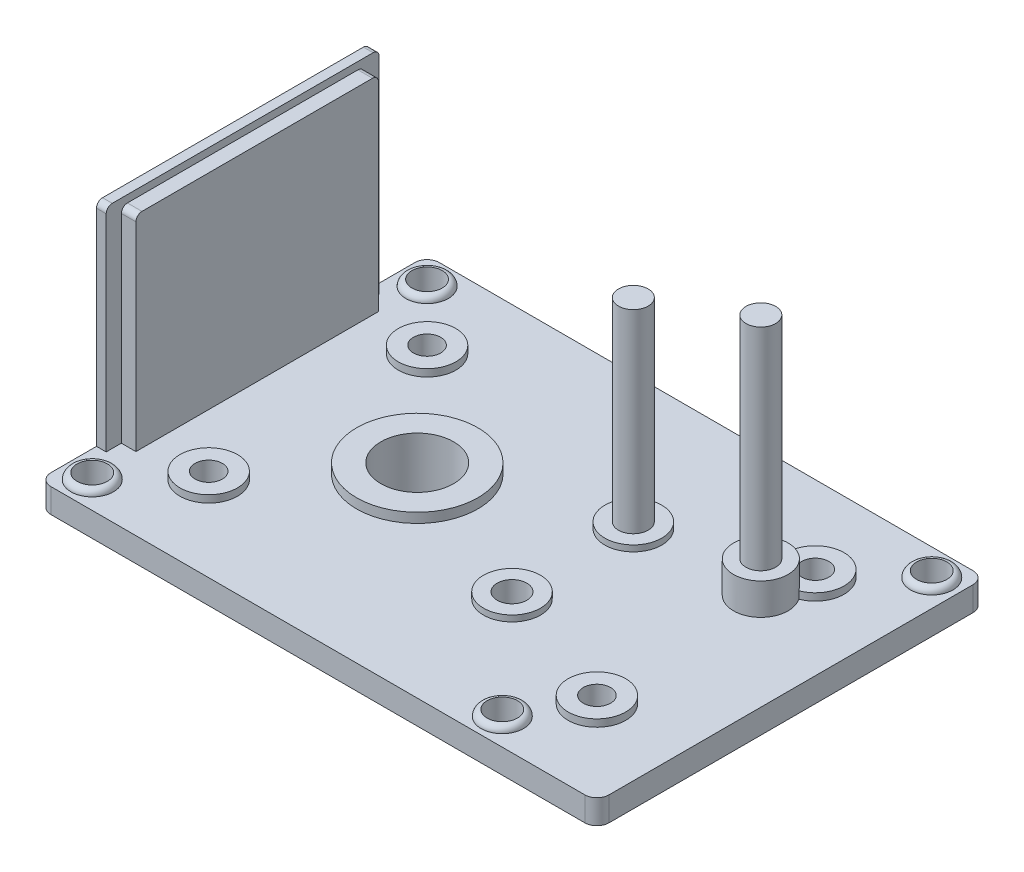
from build123d import *
from build123d.topology import SkipClean

# Parameters (mm, degrees)
SKETCH1_W                                            = 46
SKETCH1_H                                            = 32
BOSS_EXTRUDE1_DEPTH                                  = 2
BOSS_EXTRUDE2_DEPTH                                  = 17.5
SKETCH3_W                                            = 1.2
SKETCH3_H                                            = 20
CUT_EXTRUDE1_DEPTH                                   = 0.6
FILLET1_R                                            = 0.5
FILLET2_R                                            = 1
SKETCH4_R                                            = 2.375
BOSS_EXTRUDE3_DEPTH                                  = 0.6
SKETCH6_R                                            = 1
BOSS_EXTRUDE4_DEPTH                                  = 0.75
CSK_FOR_M6_HEX_SOCKET_COUNTERSUNK_CAP_SC_D           = 2.5
CSK_FOR_M6_HEX_SOCKET_COUNTERSUNK_CAP_SC_CSINK_D     = 4
CSK_FOR_M6_HEX_SOCKET_COUNTERSUNK_CAP_SC_CSINK_ANGLE = 90
BOSS_EXTRUDE5_START                                  = 0.5
SKETCH13_R                                           = 1.75
SKETCH13_R_2                                         = 1.25
BOSS_EXTRUDE5_DEPTH                                  = 0.5
FILLET3_R                                            = 0.5
SKETCH14_R                                           = 5
SKETCH14_R_2                                         = 3
BOSS_EXTRUDE6_DEPTH                                  = 0.8
SKETCH15_R                                           = 3
CUT_EXTRUDE2_DEPTH                                   = 34.034073318
SKETCH16_R                                           = 6.625
SKETCH16_R_2                                         = 3
BOSS_EXTRUDE7_DEPTH                                  = 1.6
SKETCH18_R                                           = 3.75
BOSS_EXTRUDE9_DEPTH                                  = 2
SKETCH20_R                                           = 2.35
SKETCH20_R_2                                         = 1.225
BOSS_EXTRUDE10_DEPTH                                 = 0.5
BOSS_EXTRUDE11_DEPTH                                 = 3
CUT_EXTRUDE5_START                                   = -3
SKETCH23_R                                           = 1.225
CUT_EXTRUDE5_DEPTH                                   = 3
SKETCH24_R                                           = 2.25
SKETCH24_R_2                                         = 1.225
BOSS_EXTRUDE12_DEPTH                                 = 2.6
SKETCH25_R                                           = 1.225
BOSS_EXTRUDE13_DEPTH                                 = 19
SKETCH27_R                                           = 1.225
BOSS_EXTRUDE15_DEPTH                                 = 20
SKETCH29_R                                           = 1.125
CUT_EXTRUDE6_DEPTH                                   = 37.891733491


with BuildPart() as part:
    # Sketch1 → Boss-Extrude1 (new body)
    with BuildSketch(Plane(origin=(0, 0, 0), x_dir=(1, 0, 0), z_dir=(0, 1, 0))):
        Rectangle(SKETCH1_W, SKETCH1_H)
    extrude(amount=BOSS_EXTRUDE1_DEPTH)

    # Sketch2 → Boss-Extrude2 (add)
    with BuildSketch(Plane(origin=(0, 2, 0), x_dir=(1, 0, 0), z_dir=(0, 1, 0))):
        Polygon((-23, -11.25), (-23, 11.25), (-22.2, 11.25), (-22.2, 10), (-21, 10), (-21, -10), (-22.2, -10), (-22.2, -11.25), align=None)
    extrude(amount=BOSS_EXTRUDE2_DEPTH)

    # Sketch3 → Cut-Extrude1 (cut)
    with BuildSketch(Plane(origin=(0, 19.5, 0), x_dir=(1, 0, 0), z_dir=(0, 1, 0))):
        with Locations((-21.6, 0)):
            Rectangle(SKETCH3_W, SKETCH3_H)
    extrude(amount=-CUT_EXTRUDE1_DEPTH, mode=Mode.SUBTRACT)

    # Fillet1
    fillet1_edges = [part.edges().sort_by_distance(p)[0] for p in [
        (-22.6, 19.5, -11.25),
        (-22.6, 19.5, 11.25),
        (-21.6, 18.9, 10),
        (-21.6, 18.9, -10),
    ]]
    fillet(fillet1_edges, radius=FILLET1_R)

    # Fillet2
    fillet2_edges = [part.edges().sort_by_distance(p)[0] for p in [
        (-23, 1, -16),
        (23, 1, -16),
        (23, 1, 16),
        (-23, 1, 16),
    ]]
    fillet(fillet2_edges, radius=FILLET2_R)

    # Sketch4 → Boss-Extrude3 (add)
    with BuildSketch(Plane(origin=(0, 2, 0), x_dir=(1, 0, 0), z_dir=(0, 1, 0))):
        with Locations(Location((16, 9, 0), (0, 0, 270))):
            Circle(SKETCH4_R)
        with Locations(Location((-16, 9, 0), (0, 0, 270))):
            Circle(SKETCH4_R)
        with Locations(Location((16, -9, 0), (0, 0, 90))):
            Circle(SKETCH4_R)
        with Locations(Location((-16, -9, 0), (0, 0, 90))):
            Circle(SKETCH4_R)
    extrude(amount=BOSS_EXTRUDE3_DEPTH)

    # Sketch6 → Boss-Extrude4 (add)
    with BuildSketch(Plane(origin=(0, 2, 0), x_dir=(1, 0, 0), z_dir=(0, 1, 0))):
        with Locations(Location((-16, 9, 0), (0, 0, 270))):
            Circle(SKETCH6_R)
        with Locations(Location((16, 9, 0), (0, 0, 270))):
            Circle(SKETCH6_R)
        with Locations(Location((16, -9, 0), (0, 0, 90))):
            Circle(SKETCH6_R)
        with Locations(Location((-16, -9, 0), (0, 0, 90))):
            Circle(SKETCH6_R)
    extrude(amount=BOSS_EXTRUDE4_DEPTH)

    # CSK for M6 Hex Socket Countersunk Cap Screw1 (through all)
    with Locations(Plane(origin=(0, 0, 0), x_dir=(-1, 0, 0), z_dir=(0, -1, 0))):
        with Locations((-20.8, 13.8), (20.8, 13.8), (20.8, -13.8), (-13, -13.8)):
            CounterSinkHole(CSK_FOR_M6_HEX_SOCKET_COUNTERSUNK_CAP_SC_D / 2, CSK_FOR_M6_HEX_SOCKET_COUNTERSUNK_CAP_SC_CSINK_D / 2, counter_sink_angle=CSK_FOR_M6_HEX_SOCKET_COUNTERSUNK_CAP_SC_CSINK_ANGLE)

    # Sketch13 → Boss-Extrude5 (add)
    # profile 1 of 4: a face of its own
    with BuildSketch(Plane(origin=(0, 2, 0), x_dir=(1, 0, 0), z_dir=(0, 1, 0)).offset(BOSS_EXTRUDE5_START)):
        with Locations(Location((-20.8, 13.8, 0), (0, 0, 270))):
            Circle(SKETCH13_R)
        with Locations(Location((-20.8, 13.8, 0), (0, 0, 90))):
            Circle(SKETCH13_R_2, mode=Mode.SUBTRACT)
    # profile 2 of 4: a face of its own
    with BuildSketch(Plane(origin=(0, 2, 0), x_dir=(1, 0, 0), z_dir=(0, 1, 0)).offset(BOSS_EXTRUDE5_START)):
        with Locations(Location((-20.8, -13.8, 0), (0, 0, 270))):
            Circle(SKETCH13_R)
        with Locations(Location((-20.8, -13.8, 0), (0, 0, 90))):
            Circle(SKETCH13_R_2, mode=Mode.SUBTRACT)
    # profile 3 of 4: a face of its own
    with BuildSketch(Plane(origin=(0, 2, 0), x_dir=(1, 0, 0), z_dir=(0, 1, 0)).offset(BOSS_EXTRUDE5_START)):
        with Locations(Location((13, -13.8, 0), (0, 0, 270))):
            Circle(SKETCH13_R)
        with Locations(Location((13, -13.8, 0), (0, 0, 90))):
            Circle(SKETCH13_R_2, mode=Mode.SUBTRACT)
    # profile 4 of 4: a face of its own
    with BuildSketch(Plane(origin=(0, 2, 0), x_dir=(1, 0, 0), z_dir=(0, 1, 0)).offset(BOSS_EXTRUDE5_START)):
        with Locations(Location((20.8, 13.8, 0), (0, 0, 270))):
            Circle(SKETCH13_R)
        with Locations(Location((20.8, 13.8, 0), (0, 0, 90))):
            Circle(SKETCH13_R_2, mode=Mode.SUBTRACT)
    extrude(amount=-BOSS_EXTRUDE5_DEPTH)

    # Fillet3
    fillet3_edges = [part.edges().sort_by_distance(p)[0] for p in [
        (-20.8, 2.5, -15.55),
        (-20.8, 2.5, 12.05),
        (13, 2.5, 12.05),
        (20.8, 2.5, -15.55),
    ]]
    fillet(fillet3_edges, radius=FILLET3_R - 0.0001)  # a hair under: the kernel refuses the full size

    # Sketch14 → Boss-Extrude6 (add)
    with BuildSketch(Plane(origin=(0, 2, 0), x_dir=(1, 0, 0), z_dir=(0, 1, 0))):
        with Locations(Location((-7.81, 0, 0), (0, 0, 270))):
            Circle(SKETCH14_R)
        with Locations(Location((-7.81, 0, 0), (0, 0, 270))):
            Circle(SKETCH14_R_2, mode=Mode.SUBTRACT)
    extrude(amount=BOSS_EXTRUDE6_DEPTH)

    # Sketch15 → Cut-Extrude2 (cut, through all)
    with BuildSketch(Plane(origin=(0, 2, 0), x_dir=(1, 0, 0), z_dir=(0, 1, 0))):
        with Locations(Location((-7.81, 0, 0), (0, 0, 270))):
            Circle(SKETCH15_R)
    extrude(amount=-CUT_EXTRUDE2_DEPTH, mode=Mode.SUBTRACT)

    # Sketch16 → Boss-Extrude7 (add)
    with SkipClean():  # the faces are left unmerged after this step: merging them gives an invalid solid
        with BuildSketch(Plane.XZ):
            with Locations(Location((-7.81, 0, 0), (0, 0, 90))):
                Circle(SKETCH16_R)
            with Locations(Location((-7.81, 0, 0), (0, 0, 270))):
                Circle(SKETCH16_R_2, mode=Mode.SUBTRACT)
        extrude(amount=BOSS_EXTRUDE7_DEPTH)
    add(part.part.scale(1), mode=Mode.REPLACE)  # the faces are merged on a copy

    # Sketch18 → Boss-Extrude9 (add)
    with BuildSketch(Plane.XZ):
        with Locations(Location((-16, 9, 0), (0, 0, 90))):
            Circle(SKETCH18_R)
        with Locations(Location((16, 9, 0), (0, 0, 114.638658222))):
            Circle(SKETCH18_R)
        with Locations(Location((16, -9, 0), (0, 0, 90))):
            Circle(SKETCH18_R)
        with Locations(Location((-16, -9, 0), (0, 0, 90))):
            Circle(SKETCH18_R)
    extrude(amount=BOSS_EXTRUDE9_DEPTH)

    # Sketch20 → Boss-Extrude10 (add)
    # profile 1 of 2: a face of its own
    with BuildSketch(Plane(origin=(0, 2, 0), x_dir=(1, 0, 0), z_dir=(0, 1, 0))):
        with Locations(Location((5, 5, 0), (0, 0, 270))):
            Circle(SKETCH20_R)
        with Locations(Location((5, 5, 0), (0, 0, 270))):
            Circle(SKETCH20_R_2, mode=Mode.SUBTRACT)
    # profile 2 of 2: a face of its own
    with BuildSketch(Plane(origin=(0, 2, 0), x_dir=(1, 0, 0), z_dir=(0, 1, 0))):
        with Locations(Location((5, -5, 0), (0, 0, 90))):
            Circle(SKETCH20_R)
        with Locations(Location((5, -5, 0), (0, 0, 90))):
            Circle(SKETCH20_R_2, mode=Mode.SUBTRACT)
    extrude(amount=BOSS_EXTRUDE10_DEPTH)

    # Sketch21 → Boss-Extrude11 (add)
    with BuildSketch(Plane.XZ):
        with BuildLine():
            Line((8, 5), (8, -5))
            ThreePointArc((8, -5), (5, -8), (2, -5))
            Line((2, -5), (2, 5))
            ThreePointArc((2, 5), (5, 8), (8, 5))
        make_face()
    extrude(amount=BOSS_EXTRUDE11_DEPTH)

    # Sketch23 → Cut-Extrude5 (cut)
    with BuildSketch(Plane(origin=(0, 2.5, 0), x_dir=(1, 0, 0), z_dir=(0, 1, 0)).offset(CUT_EXTRUDE5_START)):
        with Locations(Location((5, 5, 0), (0, 0, 270))):
            Circle(SKETCH23_R)
        with Locations(Location((5, -5, 0), (0, 0, 90))):
            Circle(SKETCH23_R)
    extrude(amount=CUT_EXTRUDE5_DEPTH, mode=Mode.SUBTRACT)

    # Sketch24 → Boss-Extrude12 (add)
    with BuildSketch(Plane(origin=(0, 2, 0), x_dir=(1, 0, 0), z_dir=(0, 1, 0))):
        with Locations(Location((15, 5.51, 0), (0, 0, 113.53353381))):
            Circle(SKETCH24_R)
        with Locations(Location((15, 5.51, 0), (0, 0, 270))):
            Circle(SKETCH24_R_2, mode=Mode.SUBTRACT)
    extrude(amount=BOSS_EXTRUDE12_DEPTH)

    # Sketch25 → Boss-Extrude13 (add)
    with BuildSketch(Plane(origin=(0, -0.5, 0), x_dir=(1, 0, 0), z_dir=(0, 1, 0))):
        with Locations(Location((5, 5, 0), (0, 0, 270))):
            Circle(SKETCH25_R)
    extrude(amount=BOSS_EXTRUDE13_DEPTH)

    # Sketch27 → Boss-Extrude15 (add)
    with BuildSketch(Plane(origin=(0, 2, 0), x_dir=(1, 0, 0), z_dir=(0, 1, 0))):
        with Locations(Location((15, 5.51, 0), (0, 0, 270))):
            Circle(SKETCH27_R)
    extrude(amount=BOSS_EXTRUDE15_DEPTH)

    # Sketch29 → Cut-Extrude6 (cut, through all)
    with BuildSketch(Plane.XZ.offset(2)):
        with Locations(Location((-16, 9, 0), (0, 0, 270))):
            Circle(SKETCH29_R)
        with Locations(Location((16, 9, 0), (0, 0, 270))):
            Circle(SKETCH29_R)
        with Locations(Location((16, -9, 0), (0, 0, 90))):
            Circle(SKETCH29_R)
        with Locations(Location((-16, -9, 0), (0, 0, 90))):
            Circle(SKETCH29_R)
    extrude(amount=-CUT_EXTRUDE6_DEPTH, mode=Mode.SUBTRACT)


solid = part.part
